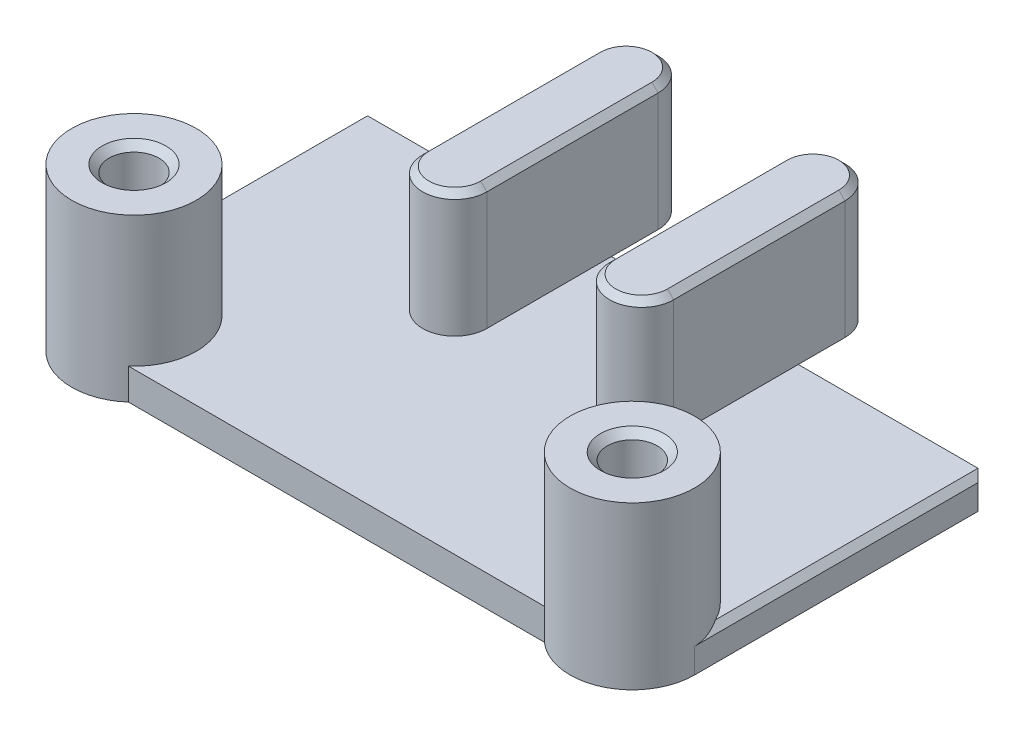
from build123d import *

# Parameters (mm, degrees)
EXTRUDE_1_DEPTH              = 1
EXTRUDE_3_DEPTH              = 4.2
EXTRUDE_3_DEPTH_BACK         = 1
SKETCH_5_R                   = 2.0000000000000004
SKETCH_5_R_2                 = 1.9999999999999996
SKETCH_7_R                   = 1.0299999999999991
EXTRUDE_4_DEPTH              = 4
HOLE_WIZARD_M2_1_D           = 1.6
HOLE_WIZARD_M2_1_DEPTH       = 4
HOLE_WIZARD_M2_1_CSINK_D     = 2.05
HOLE_WIZARD_M2_1_CSINK_ANGLE = 90
HOLE_WIZARD_M2_1_TIP         = 0.48068849522204826
CUT_EXTRUDE_1_DEPTH          = 14.435955492632447
CHAMFER_1_SIZE               = 0.2
CHAMFER_2_SIZE               = 0.2


with BuildPart() as part:
    # 草图1 → 凸台-拉伸1 (new body)
    with BuildSketch(Plane(origin=(0, 0, 0), x_dir=(1, 0, 0), z_dir=(0, 1, 0))):
        Polygon((-10.000000000000002, 5.4), (9.999999999999998, 5.4), (9.999999999999998, -5.4), (-10, -5.4), align=None)
    extrude(amount=EXTRUDE_1_DEPTH)

    # 草图5 → 凸台-拉伸3 (add, two sides: drawn at the far end of the back side and taken through both)
    with BuildSketch(Plane(origin=(0, 1, 0), x_dir=(1, 0, 0), z_dir=(0, 1, 0)).offset(-EXTRUDE_3_DEPTH_BACK)):
        with Locations(Location((-8.000000000000002, -3.900000000000001, 0), (0, 0, 270))):
            Circle(SKETCH_5_R)
        with Locations(Location((7.999999999999998, -3.900000000000001, 0), (0, 0, 270))):
            Circle(SKETCH_5_R_2)
    extrude(amount=EXTRUDE_3_DEPTH + EXTRUDE_3_DEPTH_BACK)

    # 草图7 → 凸台-拉伸4 (add)
    with BuildSketch(Plane(origin=(0, 1, 0), x_dir=(1, 0, 0), z_dir=(0, 1, 0))):
        with BuildLine():
            Line((-1.9700000000000024, 5.4), (-4.030000000000003, 5.4))
            Line((-4.030000000000002, 5.4), (-4.030000000000001, 1.3999999999999986))
            ThreePointArc((-4.030000000000002, 1.3999999999999988), (-3.0000000000000018, 2.429999999999999), (-1.9700000000000017, 1.3999999999999986))
            Line((-1.9700000000000017, 1.3999999999999986), (-1.9700000000000022, 5.4))
        make_face()
        with BuildLine():
            ThreePointArc((-1.9700000000000017, 1.3999999999999986), (-3.0000000000000018, 2.429999999999999), (-4.030000000000002, 1.3999999999999988))
            Line((-4.030000000000001, 1.3999999999999986), (-1.9700000000000015, 1.3999999999999986))
        make_face()
        with BuildLine():
            Line((-1.9700000000000015, 1.3999999999999986), (-4.030000000000001, 1.3999999999999986))
            ThreePointArc((-4.030000000000002, 1.3999999999999988), (-3.0000000000000018, 0.36999999999999855), (-1.9700000000000017, 1.3999999999999984))
        make_face()
        with BuildLine():
            Line((4.029999999999997, 5.4), (1.9699999999999989, 5.4))
            Line((1.9699999999999989, 5.4), (1.9700000000000004, 1.4000000000000021))
            ThreePointArc((1.9699999999999973, 1.400000000000002), (2.9999999999999982, 2.4300000000000024), (4.029999999999999, 1.4000000000000017))
            Line((4.029999999999997, 1.4000000000000021), (4.029999999999997, 5.4))
        make_face()
        with BuildLine():
            ThreePointArc((4.029999999999999, 1.4000000000000017), (2.9999999999999982, 2.4300000000000024), (1.9699999999999973, 1.400000000000002))
            Line((1.9700000000000004, 1.4000000000000015), (4.029999999999997, 1.400000000000002))
        make_face()
        with BuildLine():
            Line((4.029999999999997, 1.400000000000002), (1.9700000000000004, 1.4000000000000015))
            ThreePointArc((1.9699999999999973, 1.400000000000002), (2.9999999999999982, 0.3700000000000008), (4.029999999999999, 1.4000000000000015))
        make_face()
        with BuildLine():
            ThreePointArc((-1.9700000000000022, 6.8999999999999995), (-3.0000000000000013, 5.87), (-4.03, 6.8999999999999995))
            Line((-4.030000000000002, 6.8999999999999995), (-4.030000000000002, 5.4))
            Line((-4.030000000000003, 5.4), (-1.9700000000000024, 5.4))
            Line((-1.9700000000000022, 5.4), (-1.9700000000000024, 6.8999999999999995))
        make_face()
        with Locations((-3.0000000000000013, 6.8999999999999995)):
            Circle(SKETCH_7_R)
        with BuildLine():
            Line((1.9699999999999982, 6.899999999999999), (1.9699999999999989, 5.4))
            Line((1.9699999999999989, 5.4), (4.029999999999997, 5.4))
            Line((4.029999999999997, 5.4), (4.029999999999997, 6.8999999999999995))
            ThreePointArc((4.029999999999998, 6.8999999999999995), (2.9999999999999982, 5.87), (1.969999999999999, 6.8999999999999995))
        make_face()
        with Locations((2.9999999999999982, 6.8999999999999995)):
            Circle(SKETCH_7_R)
    extrude(amount=EXTRUDE_4_DEPTH)

    # M2 螺纹孔1
    with Locations(Plane(origin=(0, 5.200000000000001, 0), x_dir=(1, 0, 0), z_dir=(0, 1, 0))):
        with Locations((-8, -3.9), (8, -3.9)):
            CounterSinkHole(HOLE_WIZARD_M2_1_D / 2, HOLE_WIZARD_M2_1_CSINK_D / 2, depth=HOLE_WIZARD_M2_1_DEPTH, counter_sink_angle=HOLE_WIZARD_M2_1_CSINK_ANGLE)
            with Locations((0, 0, -(HOLE_WIZARD_M2_1_DEPTH + HOLE_WIZARD_M2_1_TIP / 2))):  # 118° drill point
                Cone(0, HOLE_WIZARD_M2_1_D / 2, HOLE_WIZARD_M2_1_TIP, mode=Mode.SUBTRACT)

    # 草图10 → 切除-拉伸1 (cut, through all)
    with BuildSketch(Plane(origin=(0, 1, 0), x_dir=(1, 0, 0), z_dir=(0, 1, 0))):
        with BuildLine():
            Line((-10.000000000000002, -5.3999999999999995), (-9.322875655532316, -5.3999999999999995))
            ThreePointArc((-9.322875655532314, -5.399999999999986), (-9.822875655532302, -4.722875655532286), (-10.000000000000002, -3.9000000000000004))
            Line((-10.000000000000002, -3.900000000000002), (-10.000000000000002, -5.3999999999999995))
        make_face()
        with BuildLine():
            Line((9.322875655532266, -5.3999999999999995), (9.999999999999998, -5.3999999999999995))
            Line((9.999999999999998, -5.3999999999999995), (9.999999999999998, -3.900000000000001))
            ThreePointArc((9.999999999999998, -3.9000000000000012), (9.822875655532286, -4.7228756555323095), (9.322875655532272, -5.400000000000019))
        make_face()
    extrude(amount=-CUT_EXTRUDE_1_DEPTH, mode=Mode.SUBTRACT)

    # 倒角1
    # the kernel refuses this chamfer: 0.2 mm, written as the material it takes off along each edge
    with BuildSketch(Plane(origin=(-10, 1, 4.414336597593362), x_dir=(-0.02749587661058736, -0.9996219169112966, 0), z_dir=(-1.6e-16, 0, -1))) as chamfer_1_piece_1_section:
        Polygon((CHAMFER_1_SIZE * 0.999621916911, -CHAMFER_1_SIZE * 0.0274958766106), (-CHAMFER_1_SIZE * 0.0274958766106, -CHAMFER_1_SIZE * 0.999621916911), (0, 0), align=None)
    chamfer_1_piece_1 = extrude(amount=10.328673195186546, mode=Mode.PRIVATE)
    chamfer_1_piece_1 = chamfer_1_piece_1 - Plane(origin=(-8.000000000000002, 0.9330678370118787, 3.900000000000001), x_dir=(-1.8e-16, 0, 1), z_dir=(0, -1, 0)) * Cylinder(2.0000000000000004, 22, mode=Mode.PRIVATE)
    add(chamfer_1_piece_1, mode=Mode.SUBTRACT)
    with BuildSketch(Plane(origin=(9.999999999999998, 1, -5.9143365975931825), x_dir=(0.02749587661058736, -0.9996219169112966, 0), z_dir=(0, 0, 1))) as chamfer_1_piece_2_section:
        Polygon((CHAMFER_1_SIZE * 0.999621916911, -CHAMFER_1_SIZE * 0.0274958766106), (-CHAMFER_1_SIZE * 0.0274958766106, -CHAMFER_1_SIZE * 0.999621916911), (0, 0), align=None)
    chamfer_1_piece_2 = extrude(amount=10.328673195185887, mode=Mode.PRIVATE)
    chamfer_1_piece_2 = chamfer_1_piece_2 - Plane(origin=(7.999999999999998, 0.9330678369662879, 3.900000000000001), x_dir=(-1.8e-16, 0, 1), z_dir=(0, -1, 0)) * Cylinder(1.9999999999999996, 22, mode=Mode.PRIVATE)
    add(chamfer_1_piece_2, mode=Mode.SUBTRACT)
    with BuildSketch(Plane(origin=(-10.000000000000002, -0.5143365975931808, -5.4), x_dir=(0.9996219169112966, 0, -0.02749587661058742), z_dir=(0, 1, 0))) as chamfer_1_piece_3:
        Polygon((CHAMFER_1_SIZE * 0.999621916911, -CHAMFER_1_SIZE * 0.0274958766106), (-CHAMFER_1_SIZE * 0.0274958766106, -CHAMFER_1_SIZE * 0.999621916911), (0, 0), align=None)
    extrude(amount=2.0286731951863617, mode=Mode.SUBTRACT)
    with BuildSketch(Plane(origin=(9.999999999999998, -0.5143365975931831, -5.4), x_dir=(-0.9996219169112966, 0, -0.02749587661058742), z_dir=(0, 1, 0))) as chamfer_1_piece_4:
        Polygon((CHAMFER_1_SIZE * 0.999621916911, CHAMFER_1_SIZE * 0.0274958766106), (-CHAMFER_1_SIZE * 0.0274958766106, CHAMFER_1_SIZE * 0.999621916911), (0, 0), align=None)
    extrude(amount=2.028673195186366, mode=Mode.SUBTRACT)

    # 倒角2
    chamfer_2_edges = [part.edges().sort_by_distance(p)[0] for p in [
        (-1.970000000000002, 5, -4.149999999999999),
        (-4.030000000000001, 5, -4.149999999999999),
        (-3.000000000000002, 5, -0.3699999999999988),
        (-3.0000000000000013, 5, -7.929999999999999),
        (4.029999999999998, 5, -4.15),
        (1.9699999999999986, 5, -4.15),
        (2.999999999999998, 5, -0.3700000000000008),
        (2.9999999999999982, 5, -7.929999999999999),
    ]]
    chamfer(chamfer_2_edges, length=CHAMFER_2_SIZE)


solid = part.part
